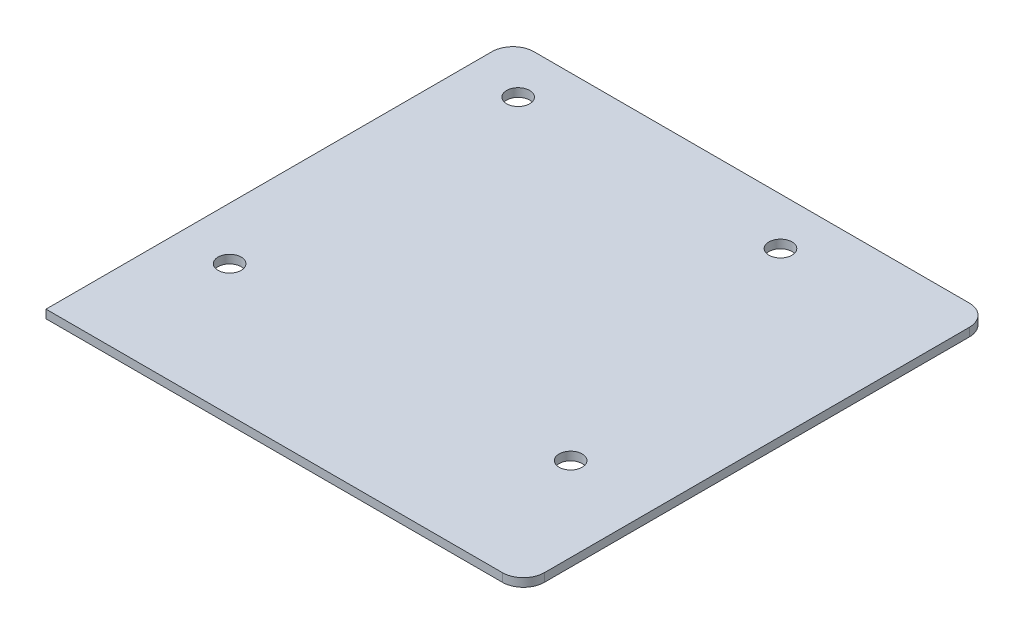
from build123d import *

# Parameters (mm, degrees)
BOSS_EXTRUDE1_DEPTH = 1.6
SKETCH2_R           = 2.2
CUT_EXTRUDE1_DEPTH  = 64.663647398


with BuildPart() as part:
    # Sketch1 → Boss-Extrude1 (new body)
    with BuildSketch(Plane(origin=(0, 0, 0), x_dir=(1, 0, 0), z_dir=(0, 1, 0))):
        with BuildLine():
            Line((-41.5, 44.5), (41.5, 44.5))
            ThreePointArc((41.5, 44.5), (44.328427125, 43.328427125), (45.5, 40.5))
            Line((45.5, 40.5), (45.5, -40.5))
            ThreePointArc((45.5, -40.5), (44.328427125, -43.328427125), (41.5, -44.5))
            Line((41.5, -44.5), (-45.5, -44.5))
            Line((-45.5, -44.5), (-45.5, 40.5))
            ThreePointArc((-45.5, 40.5), (-44.328427125, 43.328427125), (-41.5, 44.5))
        make_face()
    extrude(amount=BOSS_EXTRUDE1_DEPTH)

    # Sketch2 → Cut-Extrude1 (cut, through all)
    with BuildSketch(Plane(origin=(0, 1.6, 0), x_dir=(1, 0, 0), z_dir=(0, 1, 0))):
        with Locations((-35.5, -19.5)):
            Circle(SKETCH2_R)
        with Locations((-35.5, 35.5)):
            Circle(SKETCH2_R)
        with Locations((14.5, 35.5)):
            Circle(SKETCH2_R)
        with Locations((29.5, -19.5)):
            Circle(SKETCH2_R)
    extrude(amount=-CUT_EXTRUDE1_DEPTH, mode=Mode.SUBTRACT)


solid = part.part
